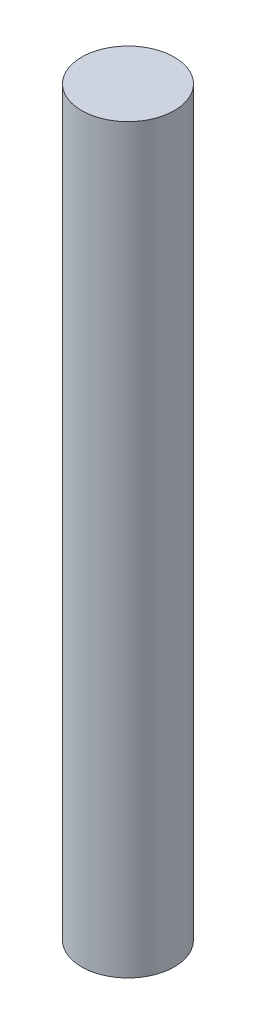
from build123d import *

# Parameters (mm, degrees)
BOSS_EXTRUDE1_DEPTH      = 40
BOSS_EXTRUDE1_DEPTH_BACK = 40
SKETCH1_R                = 5


with BuildPart() as part:
    # Sketch1 → Boss-Extrude1 (new, two sides: drawn at the far end of the back side and taken through both)
    with BuildSketch(Plane(origin=(0, 0, 0), x_dir=(1, 0, 0), z_dir=(0, 1, 0)).offset(-BOSS_EXTRUDE1_DEPTH_BACK)):
        Circle(SKETCH1_R)
    extrude(amount=BOSS_EXTRUDE1_DEPTH + BOSS_EXTRUDE1_DEPTH_BACK)


solid = part.part
